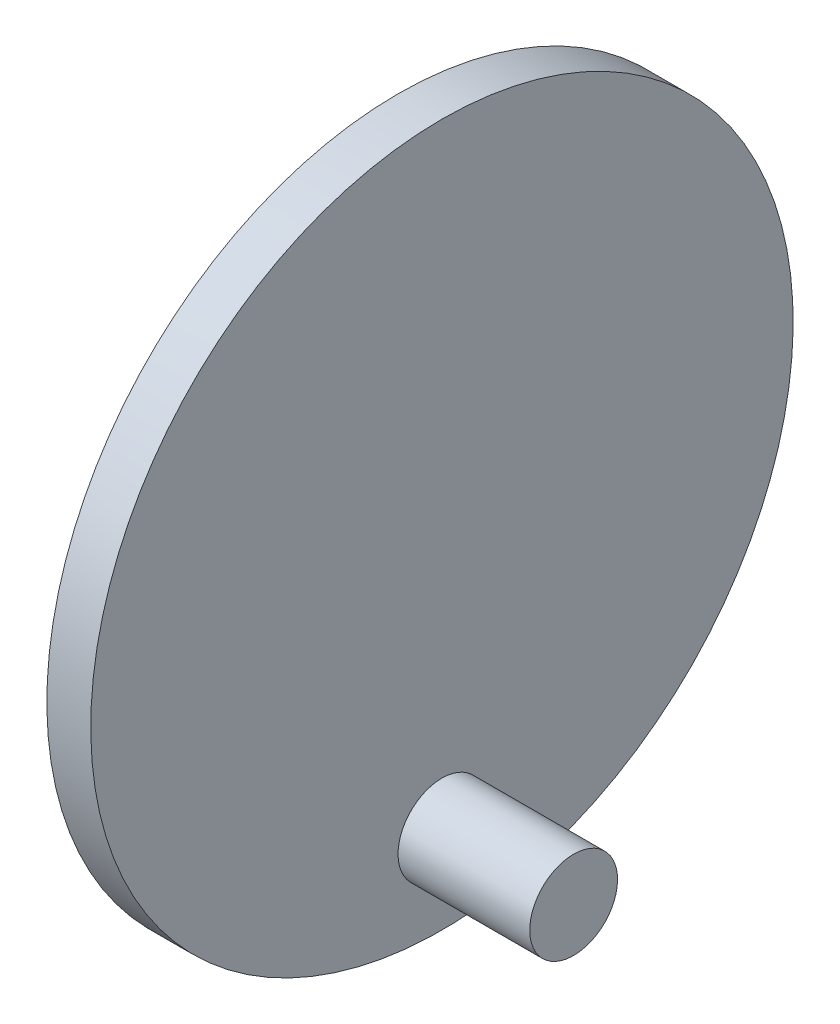
from build123d import *

# Parameters (mm, degrees)
BOSS_EXTRUDE1_DEPTH      = 5
BOSS_EXTRUDE1_DEPTH_BACK = 15
SKETCH2_R                = 7.5
SKETCH3_R                = 40
BOSS_EXTRUDE2_DEPTH      = 5
SKETCH4_R                = 5
BOSS_EXTRUDE3_DEPTH      = 15


with BuildPart() as part:
    # Sketch2 → Boss-Extrude1 (new, two sides: drawn at the far end of the back side and taken through both)
    with BuildSketch(Plane(origin=(10, 0, 0), x_dir=(0, 0, -1), z_dir=(1, 0, 0)).offset(-BOSS_EXTRUDE1_DEPTH_BACK)):
        with Locations((0, 60)):
            Circle(SKETCH2_R)
    extrude(amount=BOSS_EXTRUDE1_DEPTH + BOSS_EXTRUDE1_DEPTH_BACK)

    # Sketch3 → Boss-Extrude2 (add)
    with BuildSketch(Plane(origin=(15, 0, 0), x_dir=(0, 0, -1), z_dir=(1, 0, 0))):
        with Locations((0, 60)):
            Circle(SKETCH3_R)
    extrude(amount=BOSS_EXTRUDE2_DEPTH)

    # Sketch4 → Boss-Extrude3 (add)
    with BuildSketch(Plane(origin=(20, 0, 0), x_dir=(0, 0, -1), z_dir=(1, 0, 0))):
        with Locations((0, 30)):
            Circle(SKETCH4_R)
    extrude(amount=BOSS_EXTRUDE3_DEPTH)


solid = part.part
